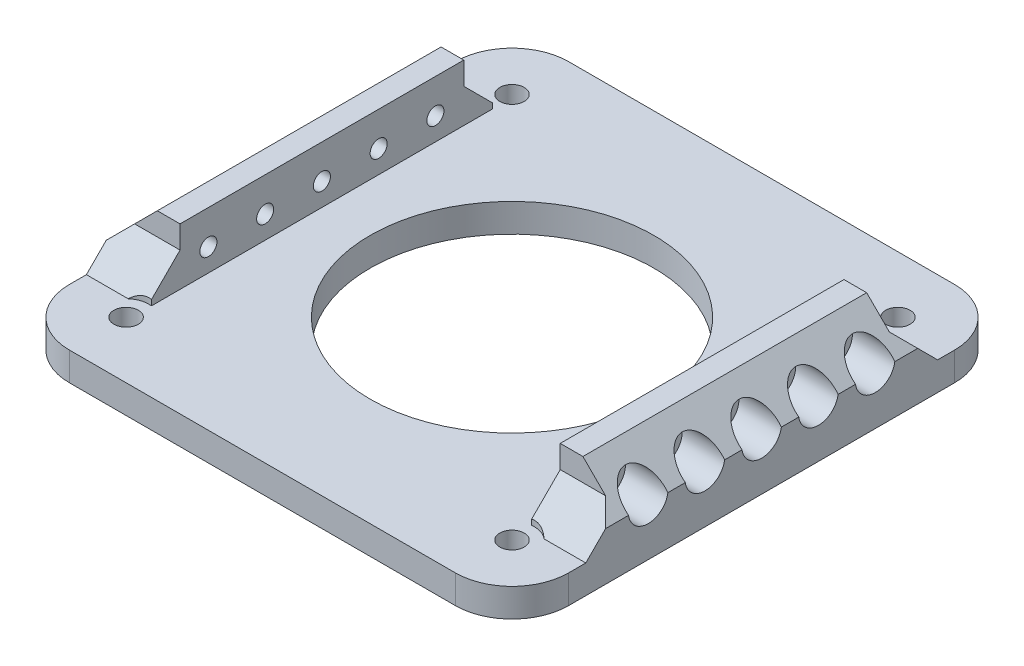
from build123d import *

# Parameters (mm, degrees)
SKETCH1_W           = 88
SKETCH1_H           = 88
BOSS_EXTRUDE1_DEPTH = 5
FILLET1_R           = 10
SKETCH2_R           = 2.15
CUT_EXTRUDE1_DEPTH  = 63.42595614
SKETCH3_W           = 4
SKETCH3_H           = 50
BOSS_EXTRUDE2_DEPTH = 10
CHAMFER1_SIZE       = 10
SKETCH4_R           = 1.5
CUT_EXTRUDE2_DEPTH  = 65.007812023
SKETCH5_R           = 3.5
CUT_EXTRUDE3_DEPTH  = 7.5
CUT_EXTRUDE4_START  = -7.5
SKETCH6_R           = 3.5
CUT_EXTRUDE4_DEPTH  = 7.5
LPATTERN2_COUNT     = 5
LPATTERN2_PITCH     = 10
CHAMFER2_SIZE       = 6
SKETCH7_R           = 25
CUT_EXTRUDE5_DEPTH  = 64.023805026
SKETCH8_R           = 4
CUT_EXTRUDE6_DEPTH  = 64.023805026


with BuildPart() as part:
    # Sketch1 → Boss-Extrude1 (new body)
    with BuildSketch(Plane(origin=(0, 0, 0), x_dir=(1, 0, 0), z_dir=(0, 1, 0))):
        Rectangle(SKETCH1_W, SKETCH1_H)
    extrude(amount=BOSS_EXTRUDE1_DEPTH)

    # Fillet1
    fillet1_edges = [part.edges().sort_by_distance(p)[0] for p in [
        (-44, 2.5, -44),
        (44, 2.5, -44),
        (44, 2.5, 44),
        (-44, 2.5, 44),
    ]]
    fillet(fillet1_edges, radius=FILLET1_R)

    # Sketch2 → Cut-Extrude1 (cut, through all)
    with BuildSketch(Plane(origin=(0, 5, 0), x_dir=(1, 0, 0), z_dir=(0, 1, 0))):
        with Locations(Location((34, 34, 0), (0, 0, 270))):
            Circle(SKETCH2_R)
        with Locations(Location((34, -34, 0), (0, 0, 270))):
            Circle(SKETCH2_R)
        with Locations(Location((-34, -34, 0), (0, 0, 270))):
            Circle(SKETCH2_R)
        with Locations(Location((-34, 34, 0), (0, 0, 270))):
            Circle(SKETCH2_R)
    extrude(amount=-CUT_EXTRUDE1_DEPTH, mode=Mode.SUBTRACT)

    # Sketch3 → Boss-Extrude2 (add)
    with BuildSketch(Plane(origin=(0, 5, 0), x_dir=(1, 0, 0), z_dir=(0, 1, 0))):
        with Locations((-35.5, 0)):
            Rectangle(SKETCH3_W, SKETCH3_H)
        with Locations((35.5, 0)):
            Rectangle(SKETCH3_W, SKETCH3_H)
    extrude(amount=BOSS_EXTRUDE2_DEPTH)

    # Chamfer1
    # the kernel refuses this chamfer: 10 mm, written as the material it adds along each edge
    with BuildSketch(Plane(origin=(37.5, 5, 25), x_dir=(0.9996219169112968, -0.027495876610586403, 0), z_dir=(0, 0, -1))) as chamfer1_piece_1_section:
        Polygon((CHAMFER1_SIZE * 0.999621916911, -CHAMFER1_SIZE * 0.0274958766106), (-CHAMFER1_SIZE * 0.0274958766106, -CHAMFER1_SIZE * 0.999621916911), (0, 0), align=None)
    chamfer1_piece_1 = extrude(amount=50, mode=Mode.PRIVATE)
    chamfer1_piece_1 = split(chamfer1_piece_1, bisect_by=Plane(origin=(44, 8.634022107, 0), z_dir=(-1, 0, 0)), keep=Keep.TOP, mode=Mode.PRIVATE)
    add(chamfer1_piece_1)
    with BuildSketch(Plane(origin=(-37.5, 5, -25), x_dir=(-0.9996219169112968, -0.027495876610586403, 0), z_dir=(0, 0, 1))) as chamfer1_piece_2_section:
        Polygon((CHAMFER1_SIZE * 0.999621916911, -CHAMFER1_SIZE * 0.0274958766106), (-CHAMFER1_SIZE * 0.0274958766106, -CHAMFER1_SIZE * 0.999621916911), (0, 0), align=None)
    chamfer1_piece_2 = extrude(amount=50, mode=Mode.PRIVATE)
    chamfer1_piece_2 = split(chamfer1_piece_2, bisect_by=Plane(origin=(-44, 8.634022107, 0), z_dir=(1, 0, 0)), keep=Keep.TOP, mode=Mode.PRIVATE)
    add(chamfer1_piece_2)

    # Sketch4 → Cut-Extrude2 (cut, symmetric)
    with BuildSketch(Plane(origin=(0, 0, 0), x_dir=(0, 0, -1), z_dir=(1, 0, 0))):
        with Locations(Location((-20, 9, 0), (0, 0, 340.528779366))):
            Circle(SKETCH4_R)
    cut_extrude2 = extrude(amount=CUT_EXTRUDE2_DEPTH, both=True, mode=Mode.SUBTRACT)

    # Sketch5 → Cut-Extrude3 (cut)
    with BuildSketch(Plane(origin=(44, 0, 0), x_dir=(0, 0, -1), z_dir=(1, 0, 0))):
        with Locations((-20, 9)):
            Circle(SKETCH5_R)
    cut_extrude3 = extrude(amount=-CUT_EXTRUDE3_DEPTH, mode=Mode.SUBTRACT)

    # Sketch6 → Cut-Extrude4 (cut)
    with BuildSketch(Plane.ZY.offset(44).offset(CUT_EXTRUDE4_START)):
        with Locations(Location((20, 9, 0), (0, 0, 180))):
            Circle(SKETCH6_R)
    cut_extrude4 = extrude(amount=CUT_EXTRUDE4_DEPTH, mode=Mode.SUBTRACT)

    # LPattern2: Cut-Extrude2, Cut-Extrude3, Cut-Extrude4 ×5
    with Locations(*[(0, 0, -i * LPATTERN2_PITCH) for i in range(1, LPATTERN2_COUNT)]):
        add(cut_extrude2, mode=Mode.SUBTRACT)
        add(cut_extrude3, mode=Mode.SUBTRACT)
        add(cut_extrude4, mode=Mode.SUBTRACT)

    # Chamfer2
    # the kernel refuses this chamfer: 6 mm, written as the material it adds along each edge
    with BuildSketch(Plane(origin=(-44, 5, 25), x_dir=(-2.4740283856501726e-13, 0.9996219169112965, -0.027495876610592693), z_dir=(1, 0, 0))) as chamfer2_piece_1_section:
        Polygon((CHAMFER2_SIZE * 0.999621916911, CHAMFER2_SIZE * 0.0274958766106), (-CHAMFER2_SIZE * 0.0274958766102, CHAMFER2_SIZE * 0.999621916911), (0, 0), align=None)
    chamfer2_piece_1 = extrude(amount=10.5, mode=Mode.PRIVATE)
    chamfer2_piece_1 = split(chamfer2_piece_1, bisect_by=Plane(origin=(-42.122041118, 10.377958882, 27.00389647), z_dir=(0.7071067811868302, -0.7071067811862648, 0)), keep=Keep.TOP, mode=Mode.PRIVATE)
    add(chamfer2_piece_1)
    with BuildSketch(Plane(origin=(-33.5, 5, -25), x_dir=(-2.474214452272925e-13, 0.9996219169112968, 0.027495876610585616), z_dir=(-1, 0, 0))) as chamfer2_piece_2_section:
        Polygon((CHAMFER2_SIZE * 0.999621916911, CHAMFER2_SIZE * 0.0274958766106), (-CHAMFER2_SIZE * 0.0274958766106, CHAMFER2_SIZE * 0.999621916911), (0, 0), align=None)
    chamfer2_piece_2 = extrude(amount=10.5, mode=Mode.PRIVATE)
    chamfer2_piece_2 = split(chamfer2_piece_2, bisect_by=Plane(origin=(-42.122041118, 10.377958882, -27.00389647), z_dir=(0.7071067811868302, -0.7071067811862648, 0)), keep=Keep.TOP, mode=Mode.PRIVATE)
    add(chamfer2_piece_2)
    with BuildSketch(Plane(origin=(44, 5, -25), x_dir=(5.708966314845366e-15, -0.027495876610159536, -0.9996219169113084), z_dir=(-1, 0, 0))) as chamfer2_piece_3_section:
        Polygon((CHAMFER2_SIZE * 0.999621916911, -CHAMFER2_SIZE * 0.0274958766106), (-CHAMFER2_SIZE * 0.0274958766102, -CHAMFER2_SIZE * 0.999621916911), (0, 0), align=None)
    chamfer2_piece_3 = extrude(amount=10.5, mode=Mode.PRIVATE)
    chamfer2_piece_3 = split(chamfer2_piece_3, bisect_by=Plane(origin=(42.122041118, 10.377958882, -27.00389647), z_dir=(-0.7071067811868302, -0.7071067811862648, 0)), keep=Keep.TOP, mode=Mode.PRIVATE)
    add(chamfer2_piece_3)
    with BuildSketch(Plane(origin=(33.5, 5, 25), x_dir=(-1.864328825330305e-14, -0.02749587661058664, 0.9996219169112968), z_dir=(1, 0, 0))) as chamfer2_piece_4_section:
        Polygon((CHAMFER2_SIZE * 0.999621916911, -CHAMFER2_SIZE * 0.0274958766106), (-CHAMFER2_SIZE * 0.0274958766106, -CHAMFER2_SIZE * 0.999621916911), (0, 0), align=None)
    chamfer2_piece_4 = extrude(amount=10.5, mode=Mode.PRIVATE)
    chamfer2_piece_4 = split(chamfer2_piece_4, bisect_by=Plane(origin=(42.122041118, 10.377958882, 27.00389647), z_dir=(-0.7071067811868302, -0.7071067811862648, 0)), keep=Keep.TOP, mode=Mode.PRIVATE)
    add(chamfer2_piece_4)

    # Sketch7 → Cut-Extrude5 (cut, through all)
    with BuildSketch(Plane(origin=(0, 5, 0), x_dir=(1, 0, 0), z_dir=(0, 1, 0))):
        with Locations(Location((0, 0, 0), (0, 0, 270))):
            Circle(SKETCH7_R)
    extrude(amount=-CUT_EXTRUDE5_DEPTH, mode=Mode.SUBTRACT)

    # Sketch8 → Cut-Extrude6 (cut, through all)
    with BuildSketch(Plane(origin=(0, 5, 0), x_dir=(1, 0, 0), z_dir=(0, 1, 0))):
        with Locations((-34, -34)):
            Circle(SKETCH8_R)
        with Locations((34, -34)):
            Circle(SKETCH8_R)
        with Locations((34, 34)):
            Circle(SKETCH8_R)
        with Locations((-34, 34)):
            Circle(SKETCH8_R)
    extrude(amount=CUT_EXTRUDE6_DEPTH, mode=Mode.SUBTRACT)


solid = part.part
